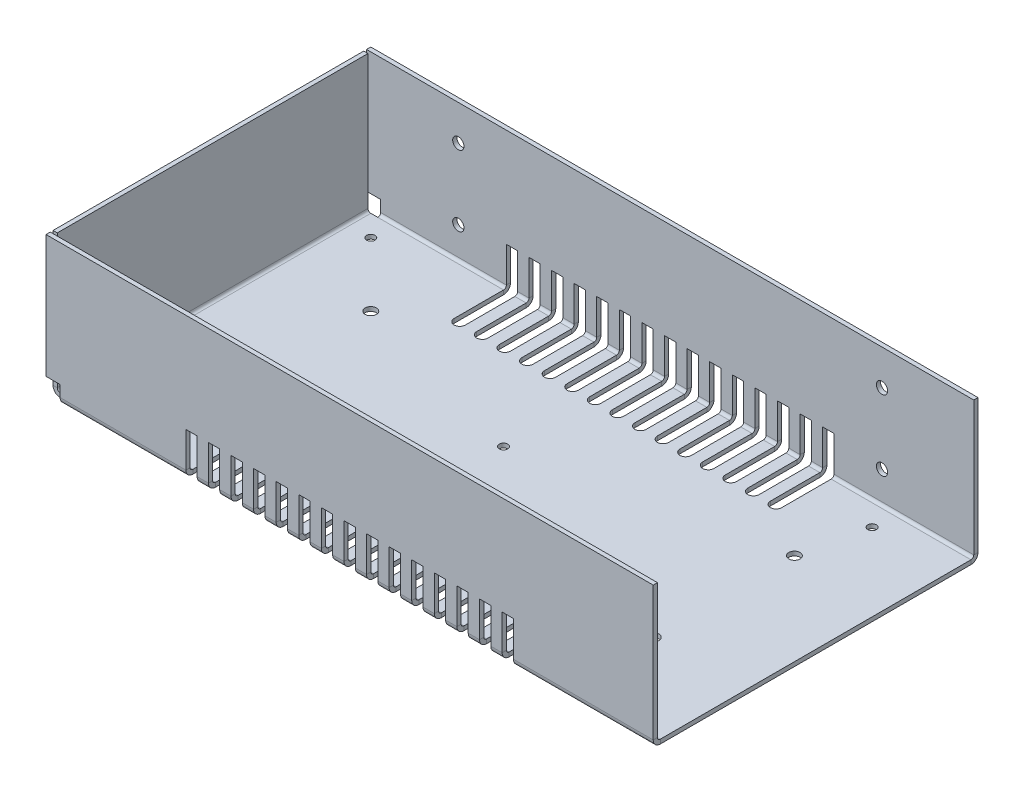
from build123d import *

# Parameters (mm, degrees)
SKETCH_1_W                       = 215
SKETCH_1_H                       = 115
SM_BASE_FLANGE_1_DEPTH           = 1.5
SM_EDGE_FLANGE_1_STRIP_W         = 8
SM_EDGE_FLANGE_1_STRIP_H         = 1.5
SM_EDGE_FLANGE_1_STRIP_CUT_DEPTH = 215
SM_EDGE_FLANGE_1_DEPTH           = 215
CUT_EXTRUDE_START                = -55
SKETCH_12_W                      = 5
SKETCH_12_H                      = 8
CUT_EXTRUDE_7_DEPTH              = 2.5
SM_EDGE_FLANGE_4_STRIP_W         = 8
SM_EDGE_FLANGE_4_STRIP_H         = 1.5
SM_EDGE_FLANGE_4_STRIP_CUT_DEPTH = 215
SM_EDGE_FLANGE_4_DEPTH           = 215
CUT_EXTRUDE_START_2              = 55
SKETCH_24_W                      = 5
SKETCH_24_H                      = 8
CUT_EXTRUDE_8_DEPTH              = 2.5
SM_EDGE_FLANGE_5_STRIP_W         = 8
SM_EDGE_FLANGE_5_STRIP_H         = 1.5
SM_EDGE_FLANGE_5_STRIP_CUT_DEPTH = 110
SM_EDGE_FLANGE_5_DEPTH           = 110
CUT_EXTRUDE_START_3              = -1.5
SKETCH_28_R                      = 1.5
SKETCH_28_R_2                    = 2
CUT_EXTRUDE_9_DEPTH              = 1.5
CUT_EXTRUDE_START_4              = -56
SKETCH_29_R                      = 2
CUT_EXTRUDE_10_DEPTH             = 1.5
CUT_EXTRUDE_11_DEPTH             = 15


# Sheet-metal steps are written as plain solids
with BuildPart() as part:
    # Sketch 1 → 基体-法兰1 (new body)
    with BuildSketch(Plane(origin=(0, 0, 0), x_dir=(1, 0, 0), z_dir=(0, 1, 0))):
        Rectangle(SKETCH_1_W, SKETCH_1_H)
    extrude(amount=-SM_BASE_FLANGE_1_DEPTH)

    # 边线-法兰1 strip (across the edge) → 边线-法兰1 strip cut (cut)
    with BuildSketch(Plane(origin=(107.5, 0, -57.5), x_dir=(0, 0, 1), z_dir=(-1, 0, 0))):
        with Locations((-1.5, -0.75)):
            Rectangle(SM_EDGE_FLANGE_1_STRIP_W, SM_EDGE_FLANGE_1_STRIP_H)
    extrude(amount=SM_EDGE_FLANGE_1_STRIP_CUT_DEPTH, mode=Mode.SUBTRACT)

    # 边线-法兰1 section (across the edge) → 边线-法兰1 (add)
    with BuildSketch(Plane(origin=(107.5, 0, -57.5), x_dir=(0, 0, 1), z_dir=(-1, 0, 0))):
        with BuildLine():
            Line((0, 1), (0, 48.5))
            Line((0, 48.5), (1.5, 48.5))
            Line((1.5, 48.5), (1.5, 1))
            ThreePointArc((1.5, 1), (1.792893219, 0.292893219), (2.5, 0))
            Line((2.5, 0), (2.5, -1.5))
            ThreePointArc((2.5, -1.5), (0.732233047, -0.767766953), (0, 1))
        make_face()
    extrude(amount=SM_EDGE_FLANGE_1_DEPTH)

    # 草图12 → 切除-拉伸7 (cut)
    with BuildSketch(Plane.XY.offset(CUT_EXTRUDE_START)):
        with Locations((-105, 1)):
            Rectangle(SKETCH_12_W, SKETCH_12_H)
    extrude(amount=-CUT_EXTRUDE_7_DEPTH, mode=Mode.SUBTRACT)

    # 边线-法兰4 strip (across the edge) → 边线-法兰4 strip cut (cut)
    with BuildSketch(Plane(origin=(-107.5, 0, 57.5), x_dir=(0, 0, -1), z_dir=(1, 0, 0))):
        with Locations((-1.5, -0.75)):
            Rectangle(SM_EDGE_FLANGE_4_STRIP_W, SM_EDGE_FLANGE_4_STRIP_H)
    extrude(amount=SM_EDGE_FLANGE_4_STRIP_CUT_DEPTH, mode=Mode.SUBTRACT)

    # 边线-法兰4 section (across the edge) → 边线-法兰4 (add)
    with BuildSketch(Plane(origin=(-107.5, 0, 57.5), x_dir=(0, 0, -1), z_dir=(1, 0, 0))):
        with BuildLine():
            Line((0, 1), (0, 48.5))
            Line((0, 48.5), (1.5, 48.5))
            Line((1.5, 48.5), (1.5, 1))
            ThreePointArc((1.5, 1), (1.792893219, 0.292893219), (2.5, 0))
            Line((2.5, 0), (2.5, -1.5))
            ThreePointArc((2.5, -1.5), (0.732233047, -0.767766953), (0, 1))
        make_face()
    extrude(amount=SM_EDGE_FLANGE_4_DEPTH)

    # 草图24 → 切除-拉伸8 (cut)
    with BuildSketch(Plane.XY.offset(CUT_EXTRUDE_START_2)):
        with Locations((-105, 1)):
            Rectangle(SKETCH_24_W, SKETCH_24_H)
    extrude(amount=CUT_EXTRUDE_8_DEPTH, mode=Mode.SUBTRACT)

    # 边线-法兰5 strip (across the edge) → 边线-法兰5 strip cut (cut)
    with BuildSketch(Plane(origin=(-107.5, 0, -55), x_dir=(1, 0, 0), z_dir=(0, 0, 1))):
        with Locations((-1.5, -0.75)):
            Rectangle(SM_EDGE_FLANGE_5_STRIP_W, SM_EDGE_FLANGE_5_STRIP_H)
    extrude(amount=SM_EDGE_FLANGE_5_STRIP_CUT_DEPTH, mode=Mode.SUBTRACT)

    # 边线-法兰5 section (across the edge) → 边线-法兰5 (add)
    with BuildSketch(Plane(origin=(-107.5, 0, -55), x_dir=(1, 0, 0), z_dir=(0, 0, 1))):
        with BuildLine():
            Line((0, 1), (0, 48.5))
            Line((0, 48.5), (1.5, 48.5))
            Line((1.5, 48.5), (1.5, 1))
            ThreePointArc((1.5, 1), (1.792893219, 0.292893219), (2.5, 0))
            Line((2.5, 0), (2.5, -1.5))
            ThreePointArc((2.5, -1.5), (0.732233047, -0.767766953), (0, 1))
        make_face()
    extrude(amount=SM_EDGE_FLANGE_5_DEPTH)

    # 草图28 → 切除-拉伸9 (cut)
    with BuildSketch(Plane(origin=(0, 0, 0), x_dir=(1, 0, 0), z_dir=(0, 1, 0)).offset(CUT_EXTRUDE_START_3)):
        with Locations(Location((-10, 7, 0), (0, 0, 90))):
            Circle(SKETCH_28_R)
        with Locations(Location((-75, -25, 0), (0, 0, 90))):
            Circle(SKETCH_28_R_2)
        with Locations(Location((-75, 25, 0), (0, 0, 90))):
            Circle(SKETCH_28_R_2)
        with Locations(Location((75, -25, 0), (0, 0, 90))):
            Circle(SKETCH_28_R_2)
        with Locations(Location((75, 25, 0), (0, 0, 90))):
            Circle(SKETCH_28_R_2)
        with Locations(Location((80, 47.5, 0), (0, 0, 90))):
            Circle(SKETCH_28_R)
        with Locations(Location((80, -47.5, 0), (0, 0, 90))):
            Circle(SKETCH_28_R)
        with Locations(Location((-97.5, -47.5, 0), (0, 0, 90))):
            Circle(SKETCH_28_R)
        with Locations(Location((-97.5, 47.5, 0), (0, 0, 90))):
            Circle(SKETCH_28_R)
    extrude(amount=CUT_EXTRUDE_9_DEPTH, mode=Mode.SUBTRACT)

    # 草图29 → 切除-拉伸10 (cut)
    with BuildSketch(Plane.XY.offset(CUT_EXTRUDE_START_4)):
        with Locations((75, 36)):
            Circle(SKETCH_29_R)
        with Locations((75, 11)):
            Circle(SKETCH_29_R)
        with Locations((-75, 36)):
            Circle(SKETCH_29_R)
        with Locations((-75, 11)):
            Circle(SKETCH_29_R)
    extrude(amount=-CUT_EXTRUDE_10_DEPTH, mode=Mode.SUBTRACT)

    # 草图30 → 切除-拉伸11 (cut)
    with BuildSketch(Plane(origin=(0, 0, 0), x_dir=(1, 0, 0), z_dir=(0, 1, 0)).offset(CUT_EXTRUDE_START_3)):
        with BuildLine():
            Line((-2, -57.5), (-2, -37.5))
            ThreePointArc((-2, -37.5), (0, -35.5), (2, -37.5))
            Line((2, -37.5), (2, -57.5))
            ThreePointArc((2, -57.5), (0, -59.5), (-2, -57.5))
        make_face()
        with BuildLine():
            Line((6, -57.5), (6, -37.5))
            ThreePointArc((6, -37.5), (8, -35.5), (10, -37.5))
            Line((10, -37.5), (10, -57.5))
            ThreePointArc((10, -57.5), (8, -59.5), (6, -57.5))
        make_face()
        with BuildLine():
            Line((14, -57.5), (14, -37.5))
            ThreePointArc((14, -37.5), (16, -35.5), (18, -37.5))
            Line((18, -37.5), (18, -57.5))
            ThreePointArc((18, -57.5), (16, -59.5), (14, -57.5))
        make_face()
        with BuildLine():
            Line((22, -57.5), (22, -37.5))
            ThreePointArc((22, -37.5), (24, -35.5), (26, -37.5))
            Line((26, -37.5), (26, -57.5))
            ThreePointArc((26, -57.5), (24, -59.5), (22, -57.5))
        make_face()
        with BuildLine():
            Line((30, -57.5), (30, -37.5))
            ThreePointArc((30, -37.5), (32, -35.5), (34, -37.5))
            Line((34, -37.5), (34, -57.5))
            ThreePointArc((34, -57.5), (32, -59.5), (30, -57.5))
        make_face()
        with BuildLine():
            Line((38, -57.5), (38, -37.5))
            ThreePointArc((38, -37.5), (40, -35.5), (42, -37.5))
            Line((42, -37.5), (42, -57.5))
            ThreePointArc((42, -57.5), (40, -59.5), (38, -57.5))
        make_face()
        with BuildLine():
            Line((46, -57.5), (46, -37.5))
            ThreePointArc((46, -37.5), (48, -35.5), (50, -37.5))
            Line((50, -37.5), (50, -57.5))
            ThreePointArc((50, -57.5), (48, -59.5), (46, -57.5))
        make_face()
        with BuildLine():
            Line((54, -57.5), (54, -37.5))
            ThreePointArc((54, -37.5), (56, -35.5), (58, -37.5))
            Line((58, -37.5), (58, -57.5))
            ThreePointArc((58, -57.5), (56, -59.5), (54, -57.5))
        make_face()
        with BuildLine():
            Line((-10, -57.5), (-10, -37.5))
            ThreePointArc((-10, -37.5), (-8, -35.5), (-6, -37.5))
            Line((-6, -37.5), (-6, -57.5))
            ThreePointArc((-6, -57.5), (-8, -59.5), (-10, -57.5))
        make_face()
        with BuildLine():
            Line((-18, -57.5), (-18, -37.5))
            ThreePointArc((-18, -37.5), (-16, -35.5), (-14, -37.5))
            Line((-14, -37.5), (-14, -57.5))
            ThreePointArc((-14, -57.5), (-16, -59.5), (-18, -57.5))
        make_face()
        with BuildLine():
            Line((-26, -57.5), (-26, -37.5))
            ThreePointArc((-26, -37.5), (-24, -35.5), (-22, -37.5))
            Line((-22, -37.5), (-22, -57.5))
            ThreePointArc((-22, -57.5), (-24, -59.5), (-26, -57.5))
        make_face()
        with BuildLine():
            Line((-34, -57.5), (-34, -37.5))
            ThreePointArc((-34, -37.5), (-32, -35.5), (-30, -37.5))
            Line((-30, -37.5), (-30, -57.5))
            ThreePointArc((-30, -57.5), (-32, -59.5), (-34, -57.5))
        make_face()
        with BuildLine():
            Line((-42, -57.5), (-42, -37.5))
            ThreePointArc((-42, -37.5), (-40, -35.5), (-38, -37.5))
            Line((-38, -37.5), (-38, -57.5))
            ThreePointArc((-38, -57.5), (-40, -59.5), (-42, -57.5))
        make_face()
        with BuildLine():
            Line((-50, -57.5), (-50, -37.5))
            ThreePointArc((-50, -37.5), (-48, -35.5), (-46, -37.5))
            Line((-46, -37.5), (-46, -57.5))
            ThreePointArc((-46, -57.5), (-48, -59.5), (-50, -57.5))
        make_face()
        with BuildLine():
            Line((-58, -57.5), (-58, -37.5))
            ThreePointArc((-58, -37.5), (-56, -35.5), (-54, -37.5))
            Line((-54, -37.5), (-54, -57.5))
            ThreePointArc((-54, -57.5), (-56, -59.5), (-58, -57.5))
        make_face()
        with BuildLine():
            Line((-58, 57.5), (-58, 37.5))
            ThreePointArc((-58, 37.5), (-56, 35.5), (-54, 37.5))
            Line((-54, 37.5), (-54, 57.5))
            ThreePointArc((-54, 57.5), (-56, 59.5), (-58, 57.5))
        make_face()
        with BuildLine():
            Line((-50, 57.5), (-50, 37.5))
            ThreePointArc((-50, 37.5), (-48, 35.5), (-46, 37.5))
            Line((-46, 37.5), (-46, 57.5))
            ThreePointArc((-46, 57.5), (-48, 59.5), (-50, 57.5))
        make_face()
        with BuildLine():
            Line((-42, 57.5), (-42, 37.5))
            ThreePointArc((-42, 37.5), (-40, 35.5), (-38, 37.5))
            Line((-38, 37.5), (-38, 57.5))
            ThreePointArc((-38, 57.5), (-40, 59.5), (-42, 57.5))
        make_face()
        with BuildLine():
            Line((-34, 57.5), (-34, 37.5))
            ThreePointArc((-34, 37.5), (-32, 35.5), (-30, 37.5))
            Line((-30, 37.5), (-30, 57.5))
            ThreePointArc((-30, 57.5), (-32, 59.5), (-34, 57.5))
        make_face()
        with BuildLine():
            Line((-26, 57.5), (-26, 37.5))
            ThreePointArc((-26, 37.5), (-24, 35.5), (-22, 37.5))
            Line((-22, 37.5), (-22, 57.5))
            ThreePointArc((-22, 57.5), (-24, 59.5), (-26, 57.5))
        make_face()
        with BuildLine():
            Line((-18, 57.5), (-18, 37.5))
            ThreePointArc((-18, 37.5), (-16, 35.5), (-14, 37.5))
            Line((-14, 37.5), (-14, 57.5))
            ThreePointArc((-14, 57.5), (-16, 59.5), (-18, 57.5))
        make_face()
        with BuildLine():
            Line((-10, 57.5), (-10, 37.5))
            ThreePointArc((-10, 37.5), (-8, 35.5), (-6, 37.5))
            Line((-6, 37.5), (-6, 57.5))
            ThreePointArc((-6, 57.5), (-8, 59.5), (-10, 57.5))
        make_face()
        with BuildLine():
            Line((-2, 57.5), (-2, 37.5))
            ThreePointArc((-2, 37.5), (0, 35.5), (2, 37.5))
            Line((2, 37.5), (2, 57.5))
            ThreePointArc((2, 57.5), (0, 59.5), (-2, 57.5))
        make_face()
        with BuildLine():
            Line((6, 57.5), (6, 37.5))
            ThreePointArc((6, 37.5), (8, 35.5), (10, 37.5))
            Line((10, 37.5), (10, 57.5))
            ThreePointArc((10, 57.5), (8, 59.5), (6, 57.5))
        make_face()
        with BuildLine():
            Line((14, 57.5), (14, 37.5))
            ThreePointArc((14, 37.5), (16, 35.5), (18, 37.5))
            Line((18, 37.5), (18, 57.5))
            ThreePointArc((18, 57.5), (16, 59.5), (14, 57.5))
        make_face()
        with BuildLine():
            Line((22, 57.5), (22, 37.5))
            ThreePointArc((22, 37.5), (24, 35.5), (26, 37.5))
            Line((26, 37.5), (26, 57.5))
            ThreePointArc((26, 57.5), (24, 59.5), (22, 57.5))
        make_face()
        with BuildLine():
            Line((30, 57.5), (30, 37.5))
            ThreePointArc((30, 37.5), (32, 35.5), (34, 37.5))
            Line((34, 37.5), (34, 57.5))
            ThreePointArc((34, 57.5), (32, 59.5), (30, 57.5))
        make_face()
        with BuildLine():
            Line((46, 57.5), (46, 37.5))
            ThreePointArc((46, 37.5), (48, 35.5), (50, 37.5))
            Line((50, 37.5), (50, 57.5))
            ThreePointArc((50, 57.5), (48, 59.5), (46, 57.5))
        make_face()
        with BuildLine():
            Line((38, 57.5), (38, 37.5))
            ThreePointArc((38, 37.5), (40, 35.5), (42, 37.5))
            Line((42, 37.5), (42, 57.5))
            ThreePointArc((42, 57.5), (40, 59.5), (38, 57.5))
        make_face()
        with BuildLine():
            Line((54, 57.5), (54, 37.5))
            ThreePointArc((54, 37.5), (56, 35.5), (58, 37.5))
            Line((58, 37.5), (58, 57.5))
            ThreePointArc((58, 57.5), (56, 59.5), (54, 57.5))
        make_face()
    extrude(amount=CUT_EXTRUDE_11_DEPTH, mode=Mode.SUBTRACT)


solid = part.part
